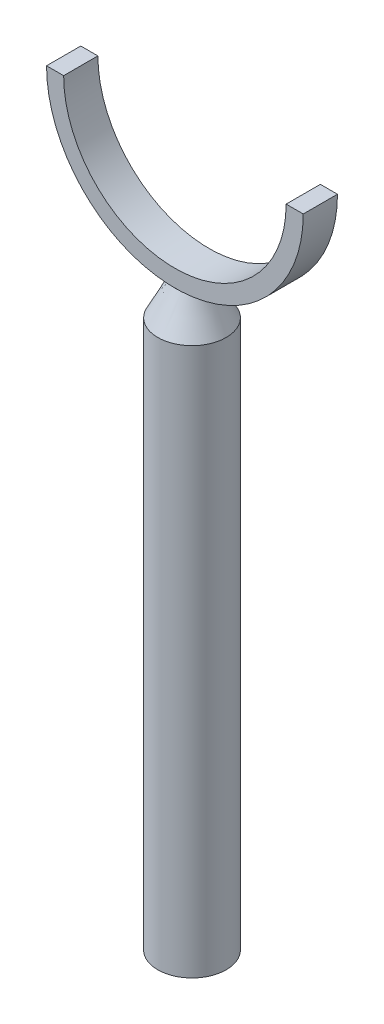
from build123d import *

# Parameters (mm, degrees)
SKETCH_1_R           = 10
EXTRUDE_1_DEPTH      = 160
EXTRUDE_2_DEPTH      = 5
EXTRUDE_2_DEPTH_BACK = 5


with BuildPart() as part:
    # Эскиз1 → Бобышка-Вытянуть1 (new body)
    with BuildSketch(Plane(origin=(0, 0, 0), x_dir=(1, 0, 0), z_dir=(0, 1, 0))):
        with Locations(Location((0, 0, 0), (0, 0, 270))):
            Circle(SKETCH_1_R)
    extrude(amount=EXTRUDE_1_DEPTH)

    # По сечениям1: read off the stored shape, not the designer's step
    # По сечениям1: loft between two sections, ruled curve by curve
    loft_1_from = [
        Edge.make_bspline([(0.941083133, 160, 9.955619646), (20.852322425, 160, 8.07345338), (18.970156159, 160, -11.837785912), (-0.941083133, 160, -9.955619646), (-20.852322425, 160, -8.07345338), (-18.970156159, 160, 11.837785912), (0.941083133, 160, 9.955619646)], [0, 0, 0, 0, 0.5, 0.5, 0.5, 1, 1, 1, 1], 3, [1, 0.333333333, 0.333333333, 1, 0.333333333, 0.333333333, 1]),
    ]
    loft_1_to = [
        Edge.make_bspline([(1.846463267, 170, 4.646565765), (11.139594796, 170, 0.953639232), (7.446668263, 170, -8.339492298), (-1.846463267, 170, -4.646565765), (-11.139594796, 170, -0.953639232), (-7.446668263, 170, 8.339492298), (1.846463267, 170, 4.646565765)], [0, 0, 0, 0, 0.5, 0.5, 0.5, 1, 1, 1, 1], 3, [1, 0.333333333, 0.333333333, 1, 0.333333333, 0.333333333, 1]),
    ]
    loft_1 = Solid(Shell([*[Face.make_surface_from_curves(loft_1_from[k], loft_1_to[k]) for k in range(1)], Face(Wire(loft_1_from)), Face(Wire(loft_1_to))]))
    add(loft_1)


with BuildPart() as body_2:
    # Эскиз8 → Бобышка-Вытянуть2 (new, two sides: drawn at the far end of the back side and taken through both)
    with BuildSketch(Plane.XY.offset(-EXTRUDE_2_DEPTH_BACK)):
        with BuildLine():
            Line((-37.5, 207.5), (-32.5, 207.5))
            ThreePointArc((-32.5, 207.5), (0, 175), (32.5, 207.5))
            Line((32.5, 207.5), (37.5, 207.5))
            ThreePointArc((37.5, 207.5), (0, 170), (-37.5, 207.5))
        make_face()
    extrude(amount=EXTRUDE_2_DEPTH + EXTRUDE_2_DEPTH_BACK)


solid = Compound([part.part, body_2.part])
